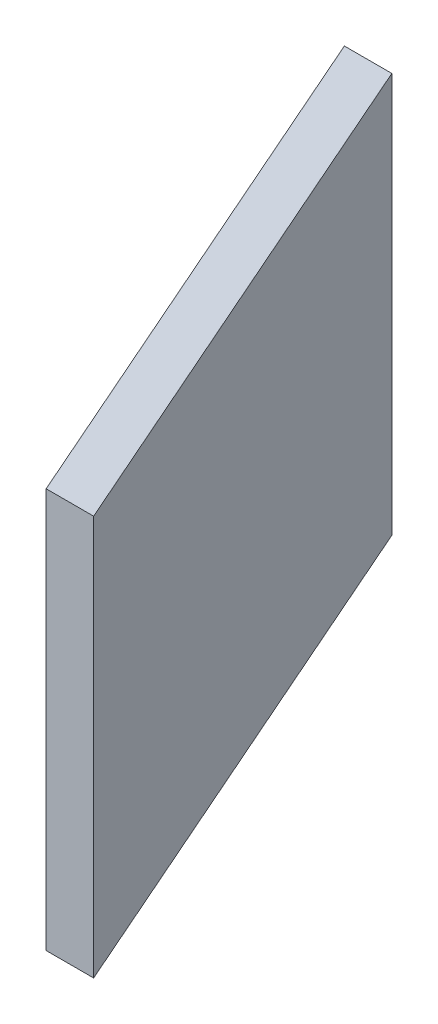
from build123d import *

# Parameters (mm, degrees)
BOSS_EXTRUDE1_DEPTH = 18.4


with BuildPart() as part:
    # Sketch1 → Boss-Extrude1 (new body)
    with BuildSketch(Plane(origin=(0, 0, 0), x_dir=(1, 0, 0), z_dir=(0, 1, 0))):
        Polygon((0, 0), (-10.780258007, 24.5), (-8.595209479, 24.5), (2.185048528, 0), align=None)
    extrude(amount=BOSS_EXTRUDE1_DEPTH)


solid = part.part
